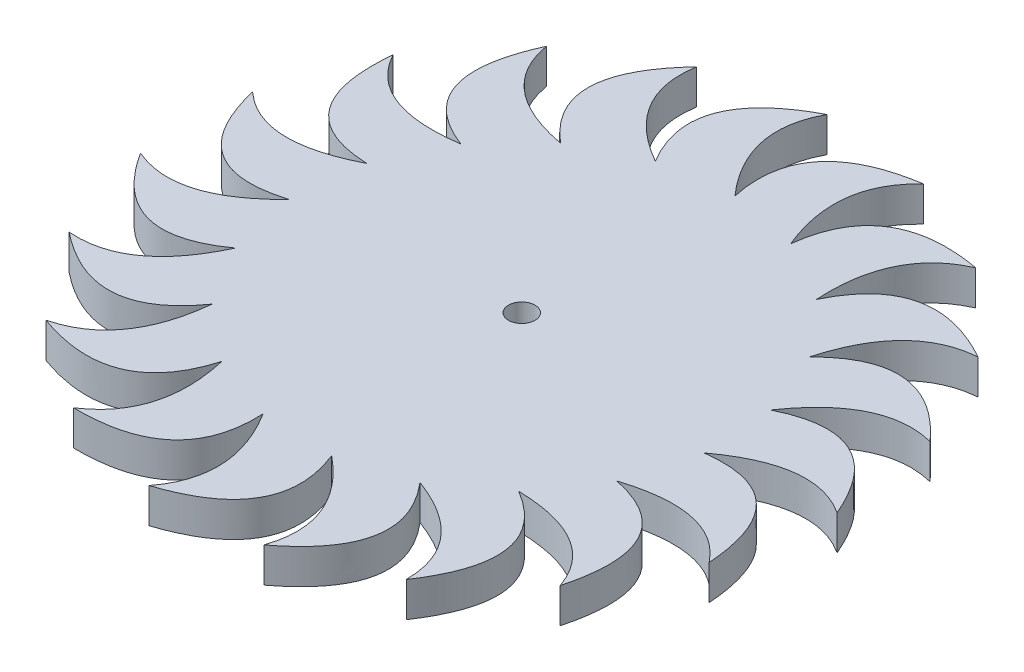
from build123d import *

# Parameters (mm, degrees)
SKETCH1_R           = 20
BOSS_EXTRUDE1_DEPTH = 2
CUT_EXTRUDE10_DEPTH = 29.354893758
CIRPATTERN1_DEPTH   = 2
SKETCH5_R           = 0.76
CUT_EXTRUDE11_DEPTH = 28.141520821
SCALE1_SCALE        = 1.5
SCALE2_SCALE        = 0.93


# Read off the part's stored shape, not the designer's step: CirPattern1
with BuildPart() as part:
    # Sketch1 → Boss-Extrude1 (new body)
    with BuildSketch(Plane(origin=(0, 0, 0), x_dir=(1, 0, 0), z_dir=(0, 1, 0))):
        with Locations(Location((0, 0, 0), (0, 0, 270))):
            Circle(SKETCH1_R)
    extrude(amount=BOSS_EXTRUDE1_DEPTH)

    # Sketch3 → Cut-Extrude10 (cut, through all)
    with BuildSketch(Plane(origin=(0, 2, 0), x_dir=(1, 0, 0), z_dir=(0, 1, 0))):
        with BuildLine():
            Line((-0.11374729, 19.999676536), (2.525531299, 21.841438752))
            Line((2.525531299, 21.841438752), (8.448237607, 18.128079913))
            add(Edge.make_bspline(
                [(0.314716636, 11.921594207), (-1.061906761, 18.280624108), (8.448237607, 18.128079913)],
                knots=[0, 0, 0, 1, 1, 1], degree=2))
            add(Edge.make_bspline(
                [(-0.11374729, 19.999676536), (-3.476973379, 16.23883842), (0.314716636, 11.921594207)],
                knots=[0, 0, 0, 1, 1, 1], degree=2))
        make_face()
    extrude(amount=-CUT_EXTRUDE10_DEPTH, mode=Mode.SUBTRACT)

    # CirPattern1 outline → CirPattern1 (cut)
    with BuildSketch(Plane(origin=(0, 0, 0), x_dir=(1, 0, 0), z_dir=(0, 1, 0))):
        with BuildLine():
            add(Edge.make_bspline(
                [(-7.207557435, 17.244057808), (-7.782239787, 13.703261178), (-3.697405485, 11.367556407)],
                knots=[0.181076354, 0.181076354, 0.181076354, 1, 1, 1], degree=2))
            add(Edge.make_bspline(
                [(-3.697405485, 11.367556407), (-6.402099222, 15.840148745), (-1.097148713, 18.619435028)],
                knots=[0, 0, 0, 0.803340706, 0.803340706, 0.803340706], degree=2))
            add(Edge.make_bspline(
                [(-0.11374729, 19.999676536), (-0.722748007, 19.318677683), (-1.097148713, 18.619435028)],
                knots=[0, 0, 0, 0.181076354, 0.181076354, 0.181076354], degree=2))
            ThreePointArc((-0.11374729, 19.999676536), (-4.271024547, -19.538637345), (8.448237607, 18.128079913))
            add(Edge.make_bspline(
                [(5.128765463, 17.936244047), (6.577979327, 18.158079147), (8.448237607, 18.128079913)],
                knots=[0.803340706, 0.803340706, 0.803340706, 1, 1, 1], degree=2))
            add(Edge.make_bspline(
                [(5.128765463, 17.936244047), (2.500458036, 15.495035196), (4.289346694, 11.142878787)],
                knots=[0.181076354, 0.181076354, 0.181076354, 1, 1, 1], degree=2))
            add(Edge.make_bspline(
                [(4.289346694, 11.142878787), (4.902086374, 16.33363986), (10.795510687, 15.268519209)],
                knots=[0, 0, 0, 0.803340706, 0.803340706, 0.803340706], degree=2))
            add(Edge.make_bspline(
                [(10.795510687, 15.268519209), (7.516952988, 13.812991814), (7.795771849, 9.115796046)],
                knots=[0.181076354, 0.181076354, 0.181076354, 1, 1, 1], degree=2))
            add(Edge.make_bspline(
                [(7.795771849, 9.115796046), (10.060748967, 13.826351118), (15.289007186, 10.905349896)],
                knots=[0, 0, 0, 0.803340706, 0.803340706, 0.803340706], degree=2))
            add(Edge.make_bspline(
                [(15.289007186, 10.905349896), (11.715481814, 10.593232934), (10.454016527, 6.060011853)],
                knots=[0.181076354, 0.181076354, 0.181076354, 1, 1, 1], degree=2))
            add(Edge.make_bspline(
                [(10.454016527, 6.060011853), (14.125785669, 9.779899189), (18.12231489, 5.319553202)],
                knots=[0, 0, 0, 0.803340706, 0.803340706, 0.803340706], degree=2))
            add(Edge.make_bspline(
                [(18.12231489, 5.319553202), (14.641068768, 6.18466939), (11.97601867, 2.306667841)],
                knots=[0.181076354, 0.181076354, 0.181076354, 1, 1, 1], degree=2))
            add(Edge.make_bspline(
                [(11.97601867, 2.306667841), (16.656686676, 4.632779929), (18.988400946, -0.883563127)],
                knots=[0, 0, 0, 0.803340706, 0.803340706, 0.803340706], degree=2))
            add(Edge.make_bspline(
                [(18.988400946, -0.883563127), (15.976681108, 1.065037449), (12.196845731, -1.737502929)],
                knots=[0.181076354, 0.181076354, 0.181076354, 1, 1, 1], degree=2))
            add(Edge.make_bspline(
                [(12.196845731, -1.737502929), (17.379189594, -1.057236426), (17.793411491, -7.031795185)],
                knots=[0, 0, 0, 0.803340706, 0.803340706, 0.803340706], degree=2))
            add(Edge.make_bspline(
                [(17.793411491, -7.031795185), (15.577584513, -4.210871331), (11.09256767, -5.6342518)],
                knots=[0.181076354, 0.181076354, 0.181076354, 1, 1, 1], degree=2))
            add(Edge.make_bspline(
                [(11.09256767, -5.6342518), (16.215000021, -6.673548315), (14.666842175, -12.458886631)],
                knots=[0, 0, 0, 0.803340706, 0.803340706, 0.803340706], degree=2))
            add(Edge.make_bspline(
                [(14.666842175, -12.458886631), (13.487027293, -9.071330369), (8.782850151, -8.961305569)],
                knots=[0.181076354, 0.181076354, 0.181076354, 1, 1, 1], degree=2))
            add(Edge.make_bspline(
                [(8.782850151, -8.961305569), (13.29027596, -11.607541197), (9.947505297, -16.576727895)],
                knots=[0, 0, 0, 0.803340706, 0.803340706, 0.803340706], degree=2))
            add(Edge.make_bspline(
                [(9.947505297, -16.576727895), (9.93155376, -12.989633509), (5.517986904, -11.358126335)],
                knots=[0.181076354, 0.181076354, 0.181076354, 1, 1, 1], degree=2))
            add(Edge.make_bspline(
                [(5.517986904, -11.358126335), (8.921956647, -15.324540386), (4.146814235, -18.939086981)],
                knots=[0, 0, 0, 0.803340706, 0.803340706, 0.803340706], degree=2))
            add(Edge.make_bspline(
                [(4.146814235, -18.939086981), (5.296454639, -15.541171808), (1.651776524, -12.564981378)],
                knots=[0.181076354, 0.181076354, 0.181076354, 1, 1, 1], degree=2))
            add(Edge.make_bspline(
                [(1.651776524, -12.564981378), (3.58341726, -17.421751343), (-2.106636126, -19.289965628)],
                knots=[0, 0, 0, 0.803340706, 0.803340706, 0.803340706], degree=2))
            add(Edge.make_bspline(
                [(-2.106636126, -19.289965628), (0.084014843, -16.4494465), (-2.396817106, -12.451089227)],
                knots=[0.181076354, 0.181076354, 0.181076354, 1, 1, 1], degree=2))
            add(Edge.make_bspline(
                [(-2.396817106, -12.451089227), (-2.146828623, -17.671908721), (-8.135187408, -17.591340689)],
                knots=[0, 0, 0, 0.803340706, 0.803340706, 0.803340706], degree=2))
            add(Edge.make_bspline(
                [(-8.135187408, -17.591340689), (-5.140916898, -15.616031929), (-6.189066045, -11.028791865)],
                knots=[0.181076354, 0.181076354, 0.181076354, 1, 1, 1], degree=2))
            add(Edge.make_bspline(
                [(-6.189066045, -11.028791865), (-7.647819946, -16.047904086), (-13.285552537, -14.027284533)],
                knots=[0, 0, 0, 0.803340706, 0.803340706, 0.803340706], degree=2))
            add(Edge.make_bspline(
                [(-13.285552537, -14.027284533), (-9.812138156, -13.131241495), (-9.314021278, -8.452217279)],
                knots=[0.181076354, 0.181076354, 0.181076354, 1, 1, 1], degree=2))
            add(Edge.make_bspline(
                [(-9.314021278, -8.452217279), (-12.323438943, -12.725723538), (-16.999609535, -8.984017946)],
                knots=[0, 0, 0, 0.803340706, 0.803340706, 0.803340706], degree=2))
            add(Edge.make_bspline(
                [(-16.999609535, -8.984017946), (-13.423449627, -9.264340798), (-11.433045416, -5.000577306)],
                knots=[0.181076354, 0.181076354, 0.181076354, 1, 1, 1], degree=2))
            add(Edge.make_bspline(
                [(-11.433045416, -5.000577306), (-15.667009745, -8.06537689), (-18.874882696, -3.008057118)],
                knots=[0, 0, 0, 0.803340706, 0.803340706, 0.803340706], degree=2))
            add(Edge.make_bspline(
                [(-18.874882696, -3.008057118), (-15.583509678, -4.434368529), (-12.316509314, -1.047910694)],
                knots=[0.181076354, 0.181076354, 0.181076354, 1, 1, 1], degree=2))
            add(Edge.make_bspline(
                [(-12.316509314, -1.047910694), (-17.316204575, -2.571885013), (-18.708157077, 3.253009868)],
                knots=[0, 0, 0, 0.803340706, 0.803340706, 0.803340706], degree=2))
            add(Edge.make_bspline(
                [(-18.708157077, 3.253009868), (-16.058242285, 0.835272872), (-11.868675951, 2.977449797)],
                knots=[0.181076354, 0.181076354, 0.181076354, 1, 1, 1], degree=2))
            add(Edge.make_bspline(
                [(-11.868675951, 2.977449797), (-17.092307584, 3.159447008), (-16.517499984, 9.120699256)],
                knots=[0, 0, 0, 0.803340706, 0.803340706, 0.803340706], degree=2))
            add(Edge.make_bspline(
                [(-16.517499984, 9.120699256), (-14.796202804, 5.973535993), (-10.13807502, 6.639293898)],
                knots=[0.181076354, 0.181076354, 0.181076354, 1, 1, 1], degree=2))
            add(Edge.make_bspline(
                [(-10.13807502, 6.639293898), (-15.019581485, 8.507540416), (-12.540303105, 13.959155852)],
                knots=[0, 0, 0, 0.803340706, 0.803340706, 0.803340706], degree=2))
            add(Edge.make_bspline(
                [(-12.540303105, 13.959155852), (-11.934152795, 10.423610295), (-7.312243985, 9.540803981)],
                knots=[0.181076354, 0.181076354, 0.181076354, 1, 1, 1], degree=2))
            add(Edge.make_bspline(
                [(-7.312243985, 9.540803981), (-11.322638312, 12.892846308), (-7.207557435, 17.244057808)],
                knots=[0, 0, 0, 0.803340706, 0.803340706, 0.803340706], degree=2))
        make_face()
    extrude(amount=CIRPATTERN1_DEPTH, mode=Mode.SUBTRACT)

    # Sketch5 → Cut-Extrude11 (cut, through all)
    with BuildSketch(Plane(origin=(0, 2, 0), x_dir=(1, 0, 0), z_dir=(0, 1, 0))):
        with Locations(Location((0, 0, 0), (0, 0, 270))):
            Circle(SKETCH5_R)
    extrude(amount=-CUT_EXTRUDE11_DEPTH, mode=Mode.SUBTRACT)


with BuildPart() as part_1:
    # Scale1: scaled about (-0.031329983, 0.999999987, 0.377918145)
    add(part.part.scale(SCALE1_SCALE).moved(Location((0.015664991, -0.499999994, -0.188959072))))


with BuildPart() as part_2:
    # Scale2: scaled about (-0.031329983, 0.999999987, 0.377918146)
    add(part_1.part.scale(SCALE2_SCALE).moved(Location((-0.002193099, 0.069999999, 0.02645427))))


solid = part_2.part
